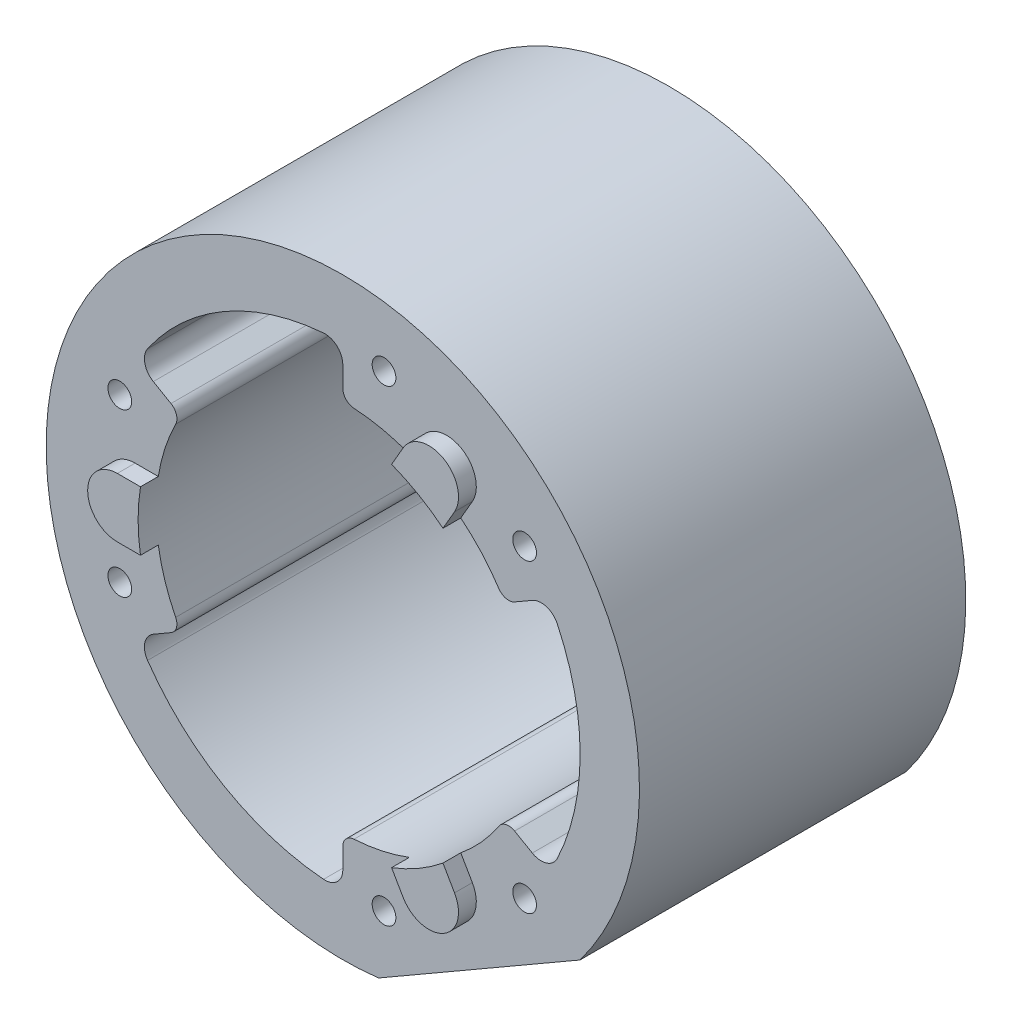
from build123d import *

# Parameters (mm, degrees)
SKETCH1_R                = 2
BOSS_EXTRUDE1_DEPTH      = 55
BOSS_EXTRUDE2_DEPTH      = 3
CUT_EXTRUDE1_DEPTH       = 90.582364336
CUT_EXTRUDE2_REACH       = 131.475
SKETCH4_R                = 2.6
BOSS_EXTRUDE3_DEPTH      = 3
BOSS_EXTRUDE3_DEPTH_BACK = 58


with BuildPart() as part:
    # Sketch1 → Boss-Extrude1 (new body)
    with BuildSketch(Plane.XY):
        with BuildLine():
            ThreePointArc((6.029437252, -49.635127545), (25, -43.301270189), (39.970562748, -30.039209603))
            ThreePointArc((39.970562748, -30.039209603), (47.426406871, -15.83464339), (50, 0))
            ThreePointArc((50, 0), (-37.426406871, 33.155151466), (6.029437252, -49.635127545))
        make_face()
        with Locations((-37.587704831, -13.680805733)):
            Circle(SKETCH1_R, mode=Mode.SUBTRACT)
        with Locations((6.945927107, -39.39231012)):
            Circle(SKETCH1_R, mode=Mode.SUBTRACT)
        with Locations((30.641777725, -25.711504387)):
            Circle(SKETCH1_R, mode=Mode.SUBTRACT)
        with Locations((-37.587704831, 13.680805733)):
            Circle(SKETCH1_R, mode=Mode.SUBTRACT)
        with BuildLine():
            ThreePointArc((-28.171439067, 14.093261543), (-28.044570655, 15.563171954), (-28.960101864, 16.720122607))
            Line((-28.960101864, 16.720122607), (-31.937438845, 18.439088915))
            ThreePointArc((-31.937438845, 18.439088915), (-33.364334049, 20.378921657), (-32.905339292, 22.742881217))
            ThreePointArc((-32.905339292, 22.742881217), (-20, 34.641016151), (-3.243243243, 39.868300356))
            ThreePointArc((-3.243243243, 39.868300356), (-0.966496832, 39.083821695), (0, 36.878177829))
            Line((0, 36.878177829), (0, 33.440245214))
            ThreePointArc((0, 33.440245214), (0.544183052, 32.068896603), (1.880597015, 31.443812664))
            ThreePointArc((1.880597015, 31.443812664), (15.75, 27.279800219), (26.290842052, 17.350551121))
            ThreePointArc((26.290842052, 17.350551121), (27.500387603, 16.505724649), (28.960101864, 16.720122607))
            Line((28.960101864, 16.720122607), (31.937438845, 18.439088915))
            ThreePointArc((31.937438845, 18.439088915), (34.330830881, 18.704900039), (36.148582536, 17.125419139))
            ThreePointArc((36.148582536, 17.125419139), (40, 0), (36.148582536, -17.125419139))
            ThreePointArc((36.148582536, -17.125419139), (34.330830881, -18.704900039), (31.937438845, -18.439088915))
            Line((31.937438845, -18.439088915), (28.960101864, -16.720122607))
            ThreePointArc((28.960101864, -16.720122607), (27.500387603, -16.505724649), (26.290842052, -17.350551121))
            ThreePointArc((26.290842052, -17.350551121), (15.75, -27.279800219), (1.880597015, -31.443812664))
            ThreePointArc((1.880597015, -31.443812664), (0.544183052, -32.068896603), (0, -33.440245214))
            Line((0, -33.440245214), (0, -36.878177829))
            ThreePointArc((0, -36.878177829), (-0.966496832, -39.083821695), (-3.243243243, -39.868300356))
            ThreePointArc((-3.243243243, -39.868300356), (-20, -34.641016151), (-32.905339292, -22.742881217))
            ThreePointArc((-32.905339292, -22.742881217), (-33.364334049, -20.378921657), (-31.937438845, -18.439088915))
            Line((-31.937438845, -18.439088915), (-28.960101864, -16.720122607))
            ThreePointArc((-28.960101864, -16.720122607), (-28.044570655, -15.563171954), (-28.171439067, -14.093261543))
            ThreePointArc((-28.171439067, -14.093261543), (-31.5, 0), (-28.171439067, 14.093261543))
        make_face(mode=Mode.SUBTRACT)
        with Locations((6.945927107, 39.39231012)):
            Circle(SKETCH1_R, mode=Mode.SUBTRACT)
        with Locations((30.641777725, 25.711504387)):
            Circle(SKETCH1_R, mode=Mode.SUBTRACT)
    extrude(amount=BOSS_EXTRUDE1_DEPTH)

    # Sketch2 → Boss-Extrude2 (add)
    with BuildSketch(Plane.XY.offset(55)):
        with BuildLine():
            Line((-35, -5), (-31.10064308, -5))
            ThreePointArc((-31.10064308, -5), (-31.5, 0), (-31.10064308, 5))
            Line((-31.10064308, 5), (-35, 5))
            ThreePointArc((-35, 5), (-40, 0), (-35, -5))
        make_face()
        with BuildLine():
            Line((21.830127019, 27.810889132), (19.880448559, 24.433946981))
            ThreePointArc((19.880448559, 24.433946981), (15.75, 27.279800219), (11.220194521, 29.433946981))
            Line((11.220194521, 29.433946981), (13.169872981, 32.810889132))
            ThreePointArc((13.169872981, 32.810889132), (20, 34.641016151), (21.830127019, 27.810889132))
        make_face()
        with BuildLine():
            Line((21.830127019, -27.810889132), (19.880448559, -24.433946981))
            ThreePointArc((19.880448559, -24.433946981), (15.75, -27.279800219), (11.220194521, -29.433946981))
            Line((11.220194521, -29.433946981), (13.169872981, -32.810889132))
            ThreePointArc((13.169872981, -32.810889132), (20, -34.641016151), (21.830127019, -27.810889132))
        make_face()
    extrude(amount=BOSS_EXTRUDE2_DEPTH)

    # Sketch3 → Cut-Extrude1 (cut, through all)
    with BuildSketch(Plane.XY.offset(55)):
        with BuildLine():
            Line((6.029437252, -49.635127545), (39.970562748, -30.039209603))
            ThreePointArc((39.970562748, -30.039209603), (25, -43.301270189), (6.029437252, -49.635127545))
        make_face()
    extrude(amount=-CUT_EXTRUDE1_DEPTH, mode=Mode.SUBTRACT)

    # Sketch4 → Cut-Extrude2 (cut, up to next)
    with BuildSketch(Plane(origin=(23, -39.837168574, 0), x_dir=(0.8660254037844386, 0.5000000000000002, 0), z_dir=(0.5000000000000002, -0.8660254037844386, 0)), mode=Mode.PRIVATE) as cut_extrude2_sk1:
        with Locations((0, 41.5)):
            Circle(SKETCH4_R)
    cut_extrude2_tool1 = extrude(cut_extrude2_sk1.sketch, amount=-CUT_EXTRUDE2_REACH, mode=Mode.PRIVATE) & part.part
    # Sketch4 → Cut-Extrude2 (cut, up to next)
    with BuildSketch(Plane(origin=(23, -39.837168574, 0), x_dir=(0.8660254037844386, 0.5000000000000002, 0), z_dir=(0.5000000000000002, -0.8660254037844386, 0)), mode=Mode.PRIVATE) as cut_extrude2_sk2:
        with Locations((0, 13.5)):
            Circle(SKETCH4_R)
    cut_extrude2_tool2 = extrude(cut_extrude2_sk2.sketch, amount=-CUT_EXTRUDE2_REACH, mode=Mode.PRIVATE) & part.part
    add(cut_extrude2_tool1.solids().sort_by_distance((23, -39.837169, 41.5))[0], mode=Mode.SUBTRACT)
    add(cut_extrude2_tool2.solids().sort_by_distance((23, -39.837169, 13.5))[0], mode=Mode.SUBTRACT)

    # Sketch2<2> → Boss-Extrude3 (add, two sides: drawn at the far end of the back side and taken through both)
    with BuildSketch(Plane.XY.offset(55).offset(-BOSS_EXTRUDE3_DEPTH_BACK)):
        with BuildLine():
            Line((-35, -5), (-31.10064308, -5))
            ThreePointArc((-31.10064308, -5), (-31.5, 0), (-31.10064308, 5))
            Line((-31.10064308, 5), (-35, 5))
            ThreePointArc((-35, 5), (-40, 0), (-35, -5))
        make_face()
        with BuildLine():
            Line((21.830127019, 27.810889132), (19.880448559, 24.433946981))
            ThreePointArc((19.880448559, 24.433946981), (15.75, 27.279800219), (11.220194521, 29.433946981))
            Line((11.220194521, 29.433946981), (13.169872981, 32.810889132))
            ThreePointArc((13.169872981, 32.810889132), (20, 34.641016151), (21.830127019, 27.810889132))
        make_face()
        with BuildLine():
            Line((21.830127019, -27.810889132), (19.880448559, -24.433946981))
            ThreePointArc((19.880448559, -24.433946981), (15.75, -27.279800219), (11.220194521, -29.433946981))
            Line((11.220194521, -29.433946981), (13.169872981, -32.810889132))
            ThreePointArc((13.169872981, -32.810889132), (20, -34.641016151), (21.830127019, -27.810889132))
        make_face()
    extrude(amount=BOSS_EXTRUDE3_DEPTH + BOSS_EXTRUDE3_DEPTH_BACK)


solid = part.part
